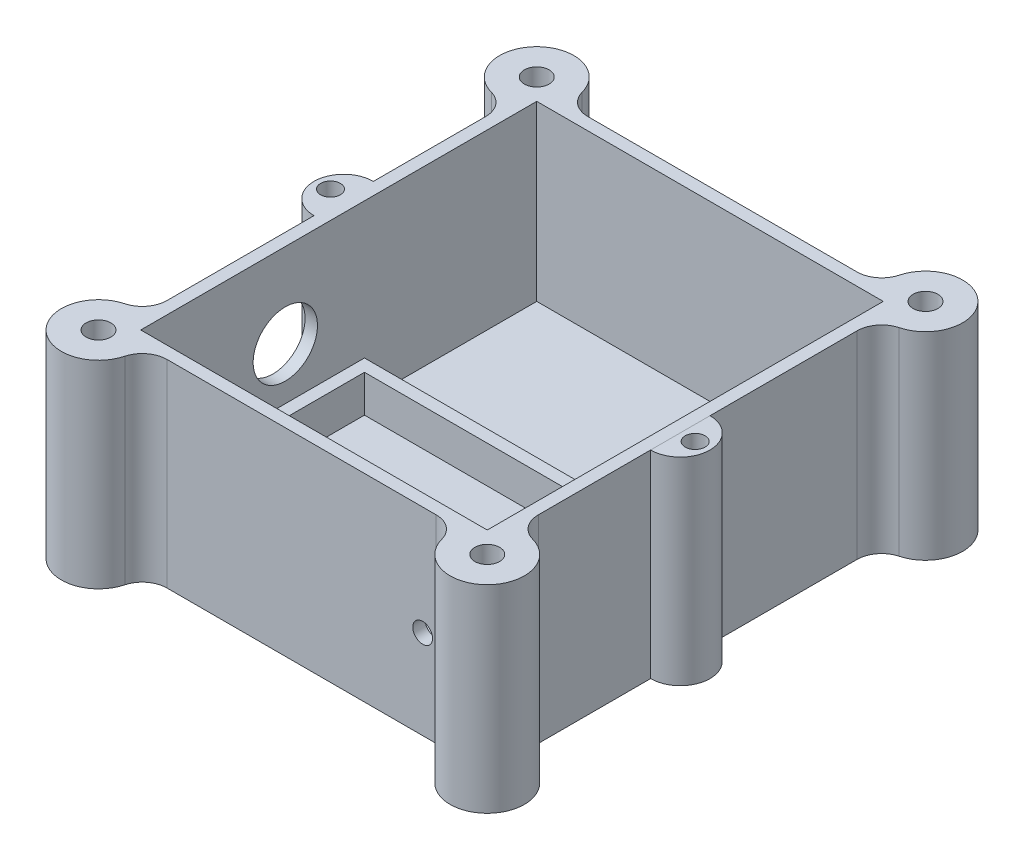
from build123d import *

# Parameters (mm, degrees)
SKETCH1_R           = 3.175
BOSS_EXTRUDE1_DEPTH = 6.35
SKETCH1_3_R         = 3.175
SKETCH1_3_W         = 88.9
SKETCH1_3_H         = 101.6
BOSS_EXTRUDE2_DEPTH = 50.8
SKETCH3_R           = 2.54
CUT_EXTRUDE1_DEPTH  = 12.7
SKETCH5_W           = 7.62
SKETCH5_H           = 50.8
REVOLVE1_ANGLE      = 180
SKETCH6_W           = 7.62
SKETCH6_H           = 50.8
REVOLVE2_ANGLE      = 180
SKETCH7_R           = 2.54
CUT_EXTRUDE2_DEPTH  = 169.424546419
SKETCH9_R           = 2.54
CUT_EXTRUDE3_DEPTH  = 169.424546419
SKETCH10_W          = 88.9
SKETCH10_H          = 57.404
SKETCH10_W_2        = 81.534
SKETCH10_H_2        = 51.054
BOSS_EXTRUDE3_DEPTH = 9.525
SKETCH11_W          = 50.8
SKETCH11_H          = 3.175
BOSS_EXTRUDE4_DEPTH = 5.08
SKETCH12_R          = 8.255
CUT_EXTRUDE4_DEPTH  = 7.62
FILLET1_R           = 3.175
FILLET2_R           = 6.35


with BuildPart() as part:
    # Sketch1 → Boss-Extrude1 (new body)
    with BuildSketch(Plane(origin=(0, 0, 0), x_dir=(1, 0, 0), z_dir=(0, 1, 0))):
        with BuildLine():
            Line((-7.011572103, 0), (-88.238427897, 0))
            ThreePointArc((-88.238427897, 0), (-104.230256121, 8.980256121), (-95.25, -7.011572103))
            Line((-95.25, -7.011572103), (-95.25, -100.938427897))
            ThreePointArc((-95.25, -100.938427897), (-104.230256121, -116.930256121), (-88.238427897, -107.95))
            Line((-88.238427897, -107.95), (-7.011572103, -107.95))
            ThreePointArc((-7.011572103, -107.95), (8.980256121, -116.930256121), (0, -100.938427897))
            Line((0, -100.938427897), (0, -7.011572103))
            ThreePointArc((0, -7.011572103), (8.980256121, 8.980256121), (-7.011572103, 0))
        make_face()
        with Locations((-97.49506403, 2.24506403)):
            Circle(SKETCH1_R, mode=Mode.SUBTRACT)
        with Locations((2.24506403, 2.24506403)):
            Circle(SKETCH1_R, mode=Mode.SUBTRACT)
        with Locations((2.24506403, -110.19506403)):
            Circle(SKETCH1_R, mode=Mode.SUBTRACT)
        with Locations((-97.49506403, -110.19506403)):
            Circle(SKETCH1_R, mode=Mode.SUBTRACT)
    extrude(amount=BOSS_EXTRUDE1_DEPTH)

    # Sketch1<3> → Boss-Extrude2 (add)
    with BuildSketch(Plane(origin=(0, 0, 0), x_dir=(1, 0, 0), z_dir=(0, 1, 0))):
        with BuildLine():
            Line((-7.011572103, 0), (-88.238427897, 0))
            ThreePointArc((-88.238427897, 0), (-104.230256121, 8.980256121), (-95.25, -7.011572103))
            Line((-95.25, -7.011572103), (-95.25, -100.938427897))
            ThreePointArc((-95.25, -100.938427897), (-104.230256121, -116.930256121), (-88.238427897, -107.95))
            Line((-88.238427897, -107.95), (-7.011572103, -107.95))
            ThreePointArc((-7.011572103, -107.95), (8.980256121, -116.930256121), (0, -100.938427897))
            Line((0, -100.938427897), (0, -7.011572103))
            ThreePointArc((0, -7.011572103), (8.980256121, 8.980256121), (-7.011572103, 0))
        make_face()
        with Locations((-97.49506403, 2.24506403)):
            Circle(SKETCH1_3_R, mode=Mode.SUBTRACT)
        with Locations((2.24506403, 2.24506403)):
            Circle(SKETCH1_3_R, mode=Mode.SUBTRACT)
        with Locations((2.24506403, -110.19506403)):
            Circle(SKETCH1_3_R, mode=Mode.SUBTRACT)
        with Locations((-97.49506403, -110.19506403)):
            Circle(SKETCH1_3_R, mode=Mode.SUBTRACT)
        with Locations((-47.625, -53.975)):
            Rectangle(SKETCH1_3_W, SKETCH1_3_H, mode=Mode.SUBTRACT)
    extrude(amount=BOSS_EXTRUDE2_DEPTH)

    # Sketch3 → Cut-Extrude1 (cut)
    with BuildSketch(Plane.XY.offset(107.95)):
        with Locations((-16.566148484, 22.86)):
            Circle(SKETCH3_R)
    extrude(amount=-CUT_EXTRUDE1_DEPTH, mode=Mode.SUBTRACT)

    # Sketch6 → Revolve2 (revolve)
    with BuildSketch(Plane.ZY.offset(95.25)):
        with Locations((53.34, 25.4)):
            Rectangle(SKETCH6_W, SKETCH6_H)
    revolve(axis=Axis((-95.25, 50.8, 49.53), (0, -1, 0)), revolution_arc=REVOLVE2_ANGLE)

    # Sketch7 → Cut-Extrude2 (cut, through all)
    with BuildSketch(Plane(origin=(0, 50.8, 0), x_dir=(1, 0, 0), z_dir=(0, 1, 0))):
        with Locations((-99.038975602, -49.13029525)):
            Circle(SKETCH7_R)
    extrude(amount=-CUT_EXTRUDE2_DEPTH, mode=Mode.SUBTRACT)

    # Sketch10 → Boss-Extrude3 (add)
    with BuildSketch(Plane(origin=(0, 6.35, 0), x_dir=(1, 0, 0), z_dir=(0, 1, 0))):
        with Locations((-47.625, -76.073)):
            Rectangle(SKETCH10_W, SKETCH10_H)
        with Locations((-48.133, -76.073)):
            Rectangle(SKETCH10_W_2, SKETCH10_H_2, mode=Mode.SUBTRACT)
    extrude(amount=BOSS_EXTRUDE3_DEPTH)

    # Sketch11 → Boss-Extrude4 (add)
    with BuildSketch(Plane(origin=(0, 6.35, 0), x_dir=(1, 0, 0), z_dir=(0, 1, 0))):
        with Locations((-48.133, -76.073)):
            Rectangle(SKETCH11_W, SKETCH11_H)
    extrude(amount=BOSS_EXTRUDE4_DEPTH)

    # Sketch12 → Cut-Extrude4 (cut)
    with BuildSketch(Plane.ZY.offset(95.25)):
        with Locations((67.691, 29.1465)):
            Circle(SKETCH12_R)
    extrude(amount=-CUT_EXTRUDE4_DEPTH, mode=Mode.SUBTRACT)

    # Fillet1
    fillet1_edges = [part.edges().sort_by_distance(p)[0] for p in [
        (-100.67006403, 0, 110.19506403),
        (-0.92993597, 0, 110.19506403),
        (-100.67006403, 0, -2.24506403),
        (-0.92993597, 0, -2.24506403),
    ]]
    fillet(fillet1_edges, radius=FILLET1_R)

    # Fillet2
    fillet2_edges = [part.edges().sort_by_distance(p)[0] for p in [
        (0, 25.4, 7.011572103),
        (0, 25.4, 100.938427897),
        (-95.25, 25.4, 100.938427897),
        (-95.25, 25.4, 7.011572103),
        (-88.238427897, 25.4, 107.95),
        (-7.011572103, 25.4, 107.95),
        (-88.238427897, 25.4, 0),
        (-7.011572103, 25.4, 0),
    ]]
    fillet(fillet2_edges, radius=FILLET2_R)


with BuildPart() as body_2:
    # Sketch5 → Revolve1 (revolve)
    with BuildSketch(Plane(origin=(0, 0, 0), x_dir=(0, 0, -1), z_dir=(1, 0, 0))):
        with Locations((-62.23, 25.4)):
            Rectangle(SKETCH5_W, SKETCH5_H)
    revolve(axis=Axis((0, 50.8, 58.42), (0, 1, 0)), revolution_arc=REVOLVE1_ANGLE)

    # Sketch9 → Cut-Extrude3 (cut, through all)
    with BuildSketch(Plane(origin=(0, 50.8, 0), x_dir=(1, 0, 0), z_dir=(0, 1, 0))):
        with Locations((3.81, -58.42)):
            Circle(SKETCH9_R)
    extrude(amount=-CUT_EXTRUDE3_DEPTH, mode=Mode.SUBTRACT)


solid = Compound([part.part, body_2.part])
